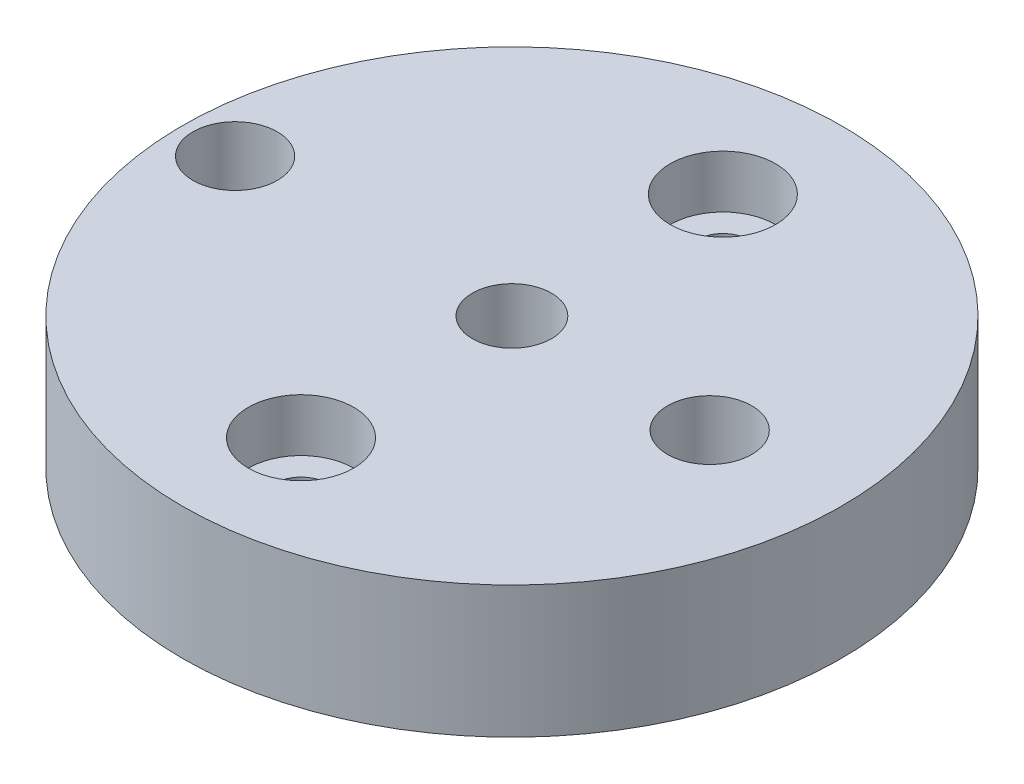
from build123d import *

# Parameters (mm, degrees)
SKETCH1_R           = 12.5
SKETCH1_R_2         = 1
SKETCH1_R_3         = 1.5
SKETCH1_R_4         = 1.6
BOSS_EXTRUDE1_DEPTH = 5
SKETCH2_R           = 2
CUT_EXTRUDE1_DEPTH  = 2


with BuildPart() as part:
    # Sketch1 → Boss-Extrude1 (new body)
    with BuildSketch(Plane(origin=(0, 0, 0), x_dir=(1, 0, 0), z_dir=(0, 1, 0))):
        Circle(SKETCH1_R)
        with Locations((0, -8)):
            Circle(SKETCH1_R_2, mode=Mode.SUBTRACT)
        with Locations((0, 8)):
            Circle(SKETCH1_R_2, mode=Mode.SUBTRACT)
        Circle(SKETCH1_R_3, mode=Mode.SUBTRACT)
        with Locations((-10.5, 0)):
            Circle(SKETCH1_R_4, mode=Mode.SUBTRACT)
        with Locations((7.5, 0)):
            Circle(SKETCH1_R_4, mode=Mode.SUBTRACT)
    extrude(amount=BOSS_EXTRUDE1_DEPTH)

    # Sketch2 → Cut-Extrude1 (cut)
    with BuildSketch(Plane(origin=(0, 5, 0), x_dir=(1, 0, 0), z_dir=(0, 1, 0))):
        with Locations((0, 8)):
            Circle(SKETCH2_R)
        with Locations((0, -8)):
            Circle(SKETCH2_R)
    extrude(amount=-CUT_EXTRUDE1_DEPTH, mode=Mode.SUBTRACT)


solid = part.part
